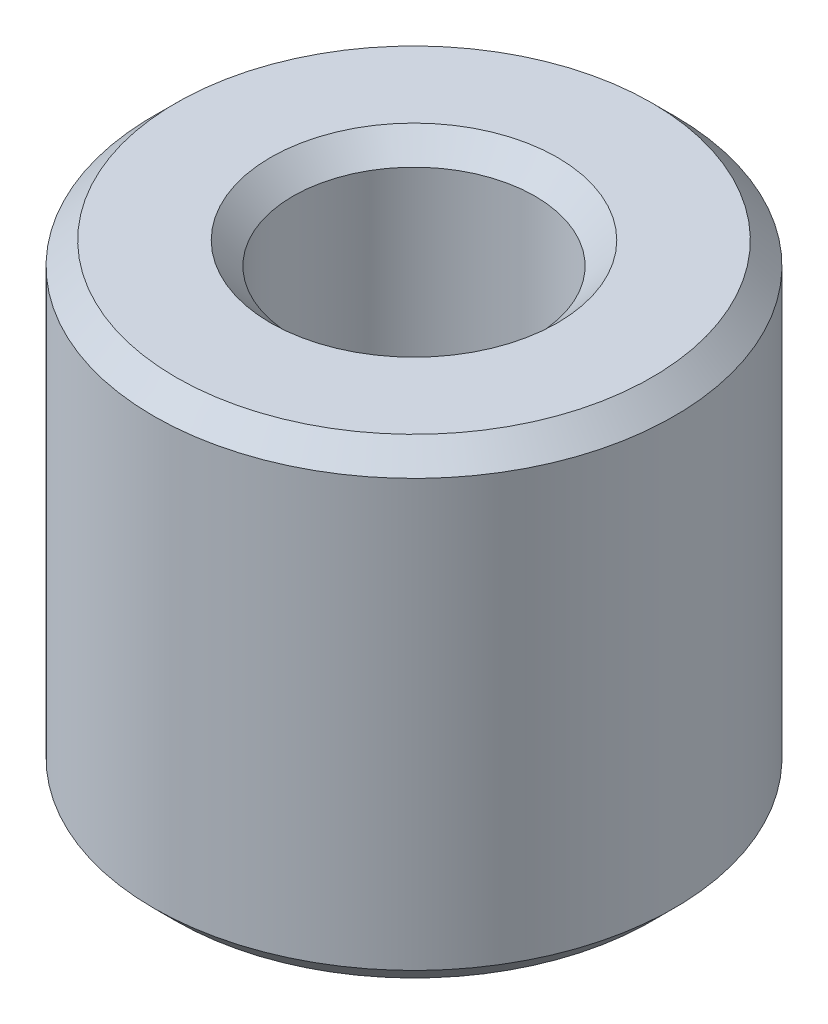
from build123d import *

# Parameters (mm, degrees)
SKETCH1_R           = 45
BOSS_EXTRUDE1_DEPTH = 81.432350334
SKETCH2_R           = 20.930085939
CUT_EXTRUDE1_DEPTH  = 104.350025065
CHAMFER1_SIZE       = 3.868763964


with BuildPart() as part:
    # Sketch1 → Boss-Extrude1 (new body)
    with BuildSketch(Plane(origin=(0, 0, 0), x_dir=(1, 0, 0), z_dir=(0, 1, 0))):
        Circle(SKETCH1_R)
    extrude(amount=BOSS_EXTRUDE1_DEPTH)

    # Sketch2 → Cut-Extrude1 (cut, through all)
    with BuildSketch(Plane(origin=(0, 0, 0), x_dir=(1, 0, 0), z_dir=(0, 1, 0))):
        Circle(SKETCH2_R)
    extrude(amount=CUT_EXTRUDE1_DEPTH, mode=Mode.SUBTRACT)

    # Chamfer1
    chamfer1_edges = [part.edges().sort_by_distance(p)[0] for p in [
        (-20.930085939, 81.432350334, 0),
        (-20.930085939, 0, 0),
        (-45, 0, 0),
        (-45, 81.432350334, 0),
    ]]
    chamfer(chamfer1_edges, length=CHAMFER1_SIZE)


solid = part.part
